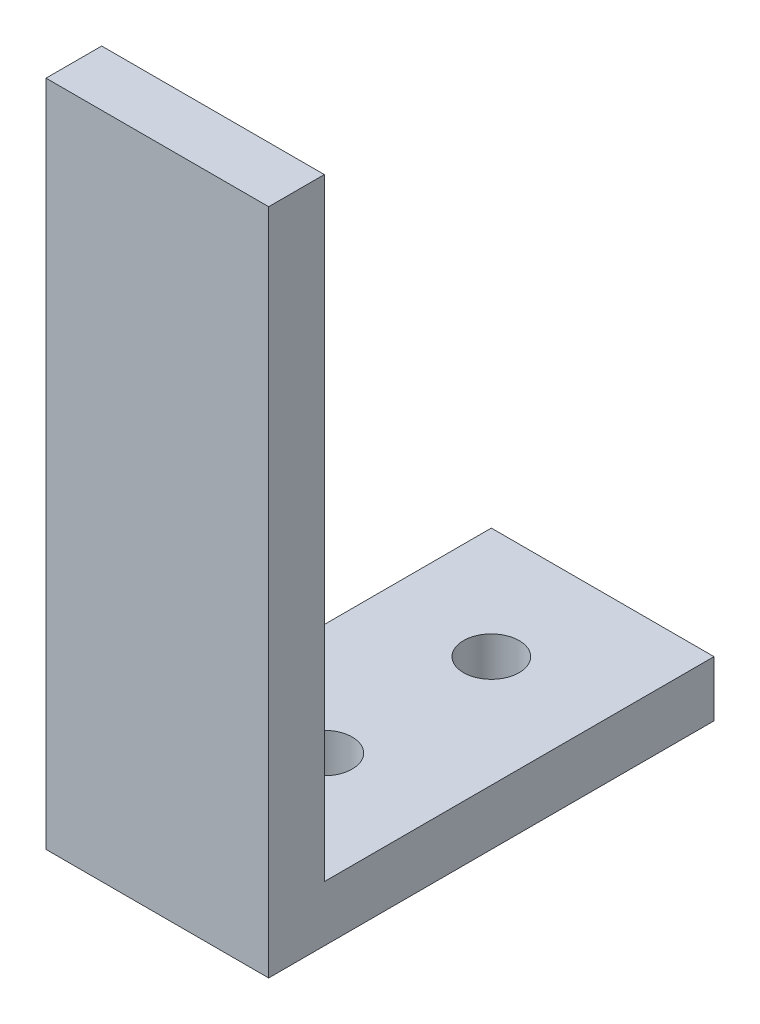
from build123d import *

# Parameters (mm, degrees)
BOSS_EXTRUDE1_DEPTH = 25.4
CUT_EXTRUDE1_REACH  = 92.027
SKETCH2_R           = 3.175


with BuildPart() as part:
    # Sketch1 → Boss-Extrude1 (new body)
    with BuildSketch(Plane(origin=(0, 0, 0), x_dir=(0, 0, -1), z_dir=(1, 0, 0))):
        Polygon((0, 76.2), (0, 0), (50.8, 0), (50.8, 6.35), (6.35, 6.35), (6.35, 76.2), align=None)
    extrude(amount=BOSS_EXTRUDE1_DEPTH)

    # Sketch2 → Cut-Extrude1 (cut, up to next)
    with BuildSketch(Plane(origin=(0, 6.35, 0), x_dir=(1, 0, 0), z_dir=(0, 1, 0)), mode=Mode.PRIVATE) as cut_extrude1_sk1:
        with Locations((12.7, 38.1)):
            Circle(SKETCH2_R)
    cut_extrude1_tool1 = extrude(cut_extrude1_sk1.sketch, amount=-CUT_EXTRUDE1_REACH, mode=Mode.PRIVATE) & part.part
    # Sketch2 → Cut-Extrude1 (cut, up to next)
    with BuildSketch(Plane(origin=(0, 6.35, 0), x_dir=(1, 0, 0), z_dir=(0, 1, 0)), mode=Mode.PRIVATE) as cut_extrude1_sk2:
        with Locations((12.7, 19.05)):
            Circle(SKETCH2_R)
    cut_extrude1_tool2 = extrude(cut_extrude1_sk2.sketch, amount=-CUT_EXTRUDE1_REACH, mode=Mode.PRIVATE) & part.part
    add(cut_extrude1_tool1.solids().sort_by_distance((12.7, 6.35, -38.1))[0], mode=Mode.SUBTRACT)
    add(cut_extrude1_tool2.solids().sort_by_distance((12.7, 6.35, -19.05))[0], mode=Mode.SUBTRACT)


solid = part.part
